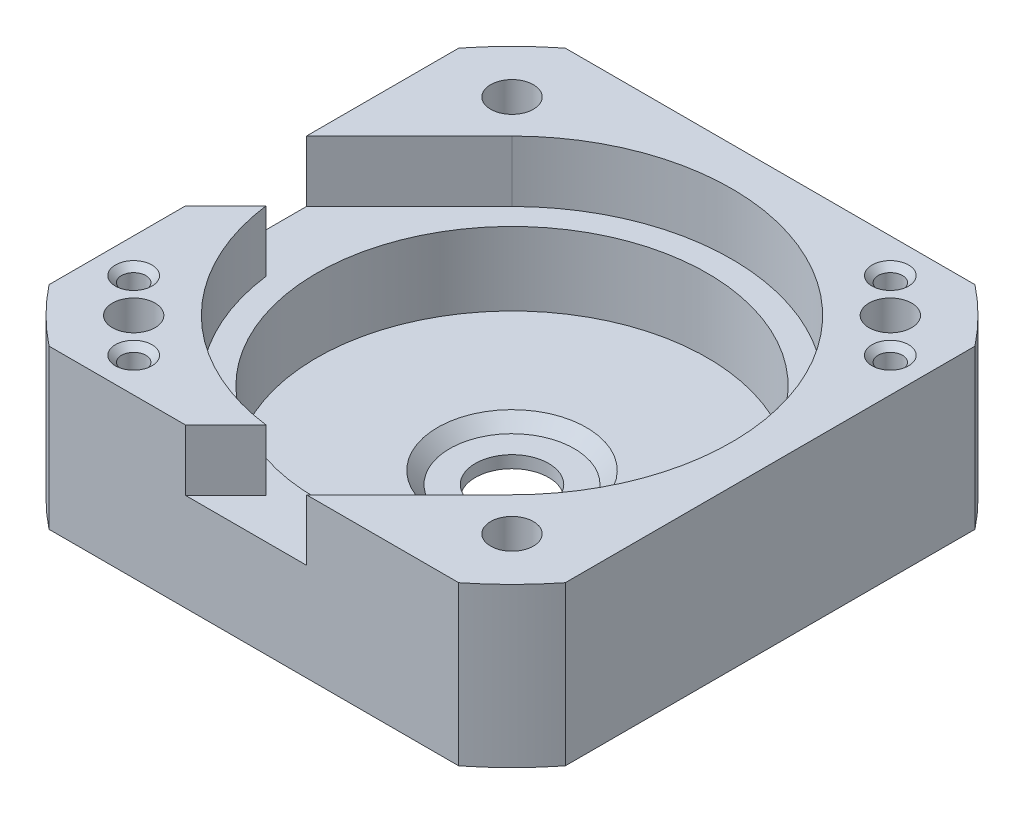
from build123d import *

# Parameters (mm, degrees)
SKETCH2_W           = 42.3
SKETCH2_H           = 42.3
BOSS_EXTRUDE1_DEPTH = 13
SKETCH3_R           = 3
CUT_EXTRUDE1_DEPTH  = 33.613570795
SKETCH4_R           = 1.75
CUT_EXTRUDE2_DEPTH  = 33.613570795
SKETCH5_R           = 29.910616844
SKETCH5_R_2         = 27
CUT_EXTRUDE4_DEPTH  = 33.613570795
SKETCH6_R           = 3
CUT_EXTRUDE5_DEPTH  = 11
CHAMFER1_SIZE       = 1.8
SKETCH7_R           = 5.1
CUT_EXTRUDE6_DEPTH  = 1
BOSS_EXTRUDE2_START = 6
SKETCH8_R           = 16
BOSS_EXTRUDE2_DEPTH = 6
CHAMFER2_SIZE       = 1
SKETCH9_R           = 1
CUT_EXTRUDE7_DEPTH  = 3
CHAMFER3_SIZE       = 0.5


with BuildPart() as part:
    # Sketch2 → Boss-Extrude1 (new body)
    with BuildSketch(Plane(origin=(0, 0, 0), x_dir=(1, 0, 0), z_dir=(0, 1, 0))):
        Rectangle(SKETCH2_W, SKETCH2_H)
    extrude(amount=BOSS_EXTRUDE1_DEPTH)

    # Sketch3 → Cut-Extrude1 (cut, through all)
    with BuildSketch(Plane(origin=(0, 13, 0), x_dir=(1, 0, 0), z_dir=(0, 1, 0))):
        with Locations(Location((0, 0, 0), (0, 0, 270))):
            Circle(SKETCH3_R)
    extrude(amount=-CUT_EXTRUDE1_DEPTH, mode=Mode.SUBTRACT)

    # Sketch4 → Cut-Extrude2 (cut, through all)
    with BuildSketch(Plane(origin=(0, 13, 0), x_dir=(1, 0, 0), z_dir=(0, 1, 0))):
        with Locations(Location((-15.5, 15.5, 0), (0, 0, 270))):
            Circle(SKETCH4_R)
        with Locations(Location((15.5, 15.5, 0), (0, 0, 270))):
            Circle(SKETCH4_R)
        with Locations(Location((15.5, -15.5, 0), (0, 0, 270))):
            Circle(SKETCH4_R)
        with Locations(Location((-15.5, -15.5, 0), (0, 0, 270))):
            Circle(SKETCH4_R)
    extrude(amount=-CUT_EXTRUDE2_DEPTH, mode=Mode.SUBTRACT)

    # Sketch5 → Cut-Extrude4 (cut, through all)
    with BuildSketch(Plane(origin=(0, 13, 0), x_dir=(1, 0, 0), z_dir=(0, 1, 0))):
        Circle(SKETCH5_R)
        Circle(SKETCH5_R_2, mode=Mode.SUBTRACT)
    extrude(amount=-CUT_EXTRUDE4_DEPTH, mode=Mode.SUBTRACT)

    # Sketch6 → Cut-Extrude5 (cut)
    with BuildSketch(Plane(origin=(0, 13, 0), x_dir=(1, 0, 0), z_dir=(0, 1, 0))):
        with BuildLine():
            Line((-12.727922061, 12.727922061), (-21.15, 4.305844123))
            Line((-21.15, 4.305844123), (-21.15, -5.593650814))
            Line((-21.15, -5.593650814), (-17.852895433, -2.296546247))
            ThreePointArc((-17.852895433, -2.296546247), (-12.727922061, -12.727922061), (-2.296546247, -17.852895433))
            Line((-2.296546247, -17.852895433), (-5.593650814, -21.15))
            Line((-5.593650814, -21.15), (4.305844123, -21.15))
            Line((4.305844123, -21.15), (12.727922061, -12.727922061))
            ThreePointArc((12.727922061, -12.727922061), (12.727922061, 12.727922061), (-12.727922061, 12.727922061))
        make_face()
        with Locations(Location((0, 0, 0), (0, 0, 270))):
            Circle(SKETCH6_R, mode=Mode.SUBTRACT)
    extrude(amount=-CUT_EXTRUDE5_DEPTH, mode=Mode.SUBTRACT)

    # Chamfer1
    chamfer1_edges = [part.edges().sort_by_distance(p)[0] for p in [
        (-15.5, 0, 13.75),
        (15.5, 0, 13.75),
        (15.5, 0, -17.25),
        (-15.5, 0, -17.25),
    ]]
    chamfer(chamfer1_edges, length=CHAMFER1_SIZE)

    # Sketch7 → Cut-Extrude6 (cut)
    with BuildSketch(Plane(origin=(0, 2, 0), x_dir=(1, 0, 0), z_dir=(0, 1, 0))):
        with Locations(Location((0, 0, 0), (0, 0, 270))):
            Circle(SKETCH7_R)
    extrude(amount=-CUT_EXTRUDE6_DEPTH, mode=Mode.SUBTRACT)

    # Sketch8 → Boss-Extrude2 (add)
    with BuildSketch(Plane(origin=(0, 2, 0), x_dir=(1, 0, 0), z_dir=(0, 1, 0)).offset(BOSS_EXTRUDE2_START)):
        with BuildLine():
            Line((-21.15, 4.305844123), (-21.15, -5.593650814))
            Line((-21.15, -5.593650814), (-17.852895433, -2.296546247))
            ThreePointArc((-17.852895433, -2.296546247), (-12.727922061, -12.727922061), (-2.296546247, -17.852895433))
            Line((-2.296546247, -17.852895433), (-5.593650814, -21.15))
            Line((-5.593650814, -21.15), (4.305844123, -21.15))
            Line((4.305844123, -21.15), (12.727922061, -12.727922061))
            ThreePointArc((12.727922061, -12.727922061), (12.727922061, 12.727922061), (-12.727922061, 12.727922061))
            Line((-12.727922061, 12.727922061), (-21.15, 4.305844123))
        make_face()
        with Locations(Location((0, 0, 0), (0, 0, 270))):
            Circle(SKETCH8_R, mode=Mode.SUBTRACT)
    extrude(amount=-BOSS_EXTRUDE2_DEPTH)

    # Chamfer2
    chamfer2_edges = [part.edges().sort_by_distance(p)[0] for p in [
        (0, 2, -5.1),
    ]]
    chamfer(chamfer2_edges, length=CHAMFER2_SIZE - 0.0001)  # a hair under: the kernel refuses the full size

    # Sketch9 → Cut-Extrude7 (cut)
    with BuildSketch(Plane(origin=(0, 13, 0), x_dir=(1, 0, 0), z_dir=(0, 1, 0))):
        with Locations(Location((12.671572875, 18.328427125, 0), (0, 0, 270))):
            Circle(SKETCH9_R)
        with Locations(Location((18.328427125, 12.671572875, 0), (0, 0, 270))):
            Circle(SKETCH9_R)
        with Locations(Location((-12.671572875, -18.328427125, 0), (0, 0, 90))):
            Circle(SKETCH9_R)
        with Locations(Location((-18.328427125, -12.671572875, 0), (0, 0, 90))):
            Circle(SKETCH9_R)
    extrude(amount=-CUT_EXTRUDE7_DEPTH, mode=Mode.SUBTRACT)

    # Chamfer3
    chamfer3_edges = [part.edges().sort_by_distance(p)[0] for p in [
        (18.328427125, 13, -13.671572875),
        (12.671572875, 13, -19.328427125),
        (-12.671572875, 13, 19.328427125),
        (-18.328427125, 13, 13.671572875),
    ]]
    chamfer(chamfer3_edges, length=CHAMFER3_SIZE)


solid = part.part
